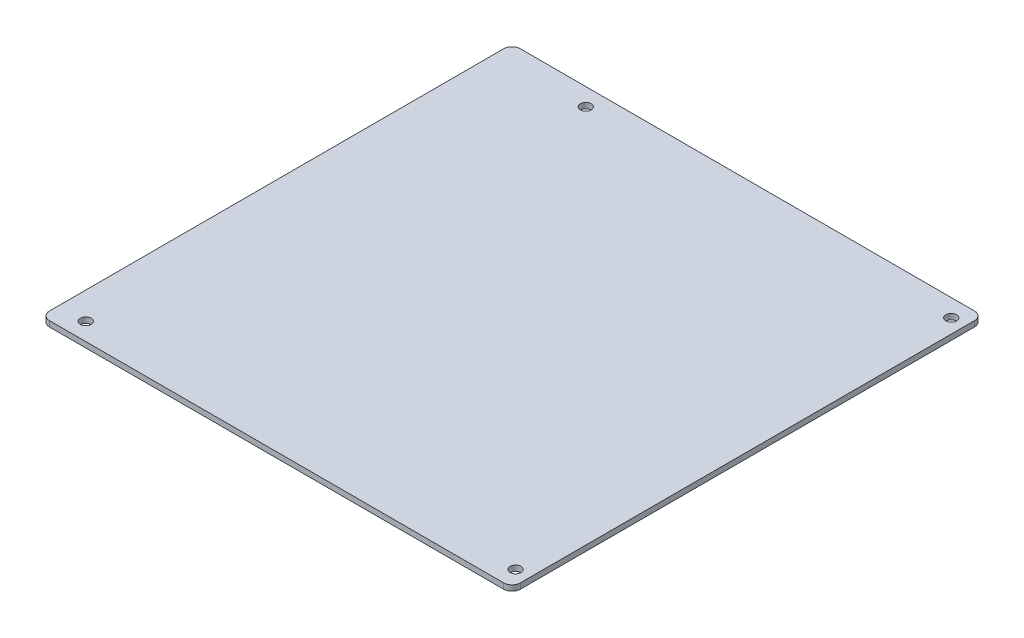
from build123d import *

# Parameters (mm, degrees)
SKETCH1_W                      = 170.18
SKETCH1_H                      = 170.18
BOSS_EXTRUDE1_DEPTH            = 2
FILLET1_R                      = 3
F_3_9_3_9_DIAMETER_HOLE1_D     = 3.9
F_3_9_3_9_DIAMETER_HOLE1_DEPTH = 18.75
F_3_9_3_9_DIAMETER_HOLE1_TIP   = 1.171678207


with BuildPart() as part:
    # Sketch1 → Boss-Extrude1 (new body)
    with BuildSketch(Plane(origin=(0, 0, 0), x_dir=(1, 0, 0), z_dir=(0, 1, 0))):
        Rectangle(SKETCH1_W, SKETCH1_H)
    extrude(amount=BOSS_EXTRUDE1_DEPTH)

    # Fillet1
    fillet1_edges = [part.edges().sort_by_distance(p)[0] for p in [
        (-85.09, 1, -85.09),
        (85.09, 1, -85.09),
        (85.09, 1, 85.09),
        (-85.09, 1, 85.09),
    ]]
    fillet(fillet1_edges, radius=FILLET1_R)

    # Ø3.9 (3.9) Diameter Hole1
    with Locations(Plane(origin=(0, 2, 0), x_dir=(1, 0, 0), z_dir=(0, 1, 0))):
        with Locations((-75.29, -78.74), (80.01, -78.74), (80.01, 78.74), (-52.07, 78.74)):
            Hole(F_3_9_3_9_DIAMETER_HOLE1_D / 2, depth=F_3_9_3_9_DIAMETER_HOLE1_DEPTH)
            with Locations((0, 0, -(F_3_9_3_9_DIAMETER_HOLE1_DEPTH + F_3_9_3_9_DIAMETER_HOLE1_TIP / 2))):  # 118° drill point
                Cone(0, F_3_9_3_9_DIAMETER_HOLE1_D / 2, F_3_9_3_9_DIAMETER_HOLE1_TIP, mode=Mode.SUBTRACT)


solid = part.part
